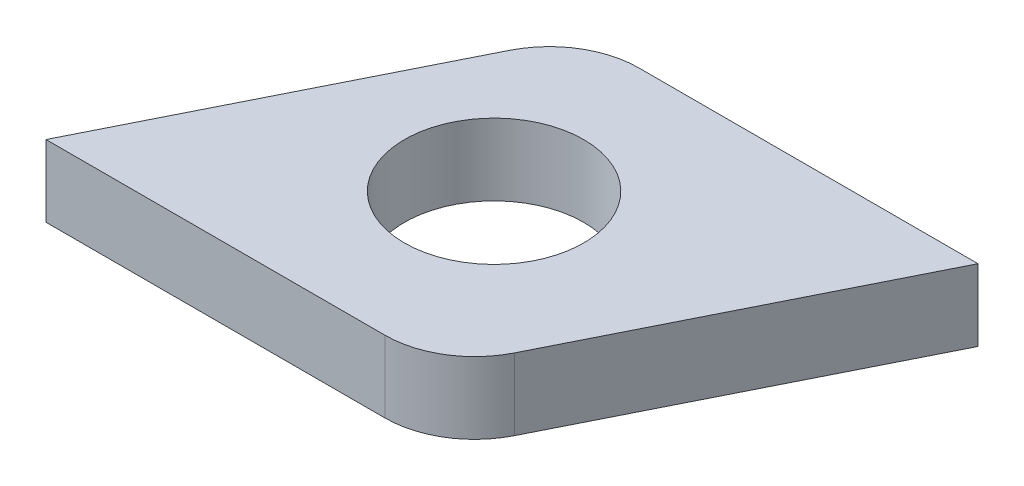
from build123d import *

# Parameters (mm, degrees)
EXTRUDE_1_DEPTH     = 4
SKETCH_2_R          = 5
CUT_EXTRUDE_1_DEPTH = 38.947331925


with BuildPart() as part:
    # Эскиз1 → Бобышка-Вытянуть1 (new body)
    with BuildSketch(Plane(origin=(0, 0, 0), x_dir=(1, 0, 0), z_dir=(0, 1, 0))):
        with BuildLine():
            Line((0, 0), (18.90983006, 0))
            ThreePointArc((18.90983006, 0), (21.538485621, 0.746745958), (23.381966015, 2.763932023))
            Line((23.381966015, 2.763932023), (32.000000004, 20))
            Line((32.000000004, 20), (13.090169944, 20))
            ThreePointArc((13.090169944, 20), (10.461514383, 19.253254042), (8.618033989, 17.236067977))
            Line((8.618033989, 17.236067977), (0, 0))
        make_face()
    extrude(amount=EXTRUDE_1_DEPTH)

    # Эскиз2 → Вырез-Вытянуть1 (cut, through all)
    with BuildSketch(Plane(origin=(0, 4, 0), x_dir=(1, 0, 0), z_dir=(0, 1, 0))):
        with Locations((15, 10)):
            Circle(SKETCH_2_R)
    extrude(amount=-CUT_EXTRUDE_1_DEPTH, mode=Mode.SUBTRACT)


solid = part.part
